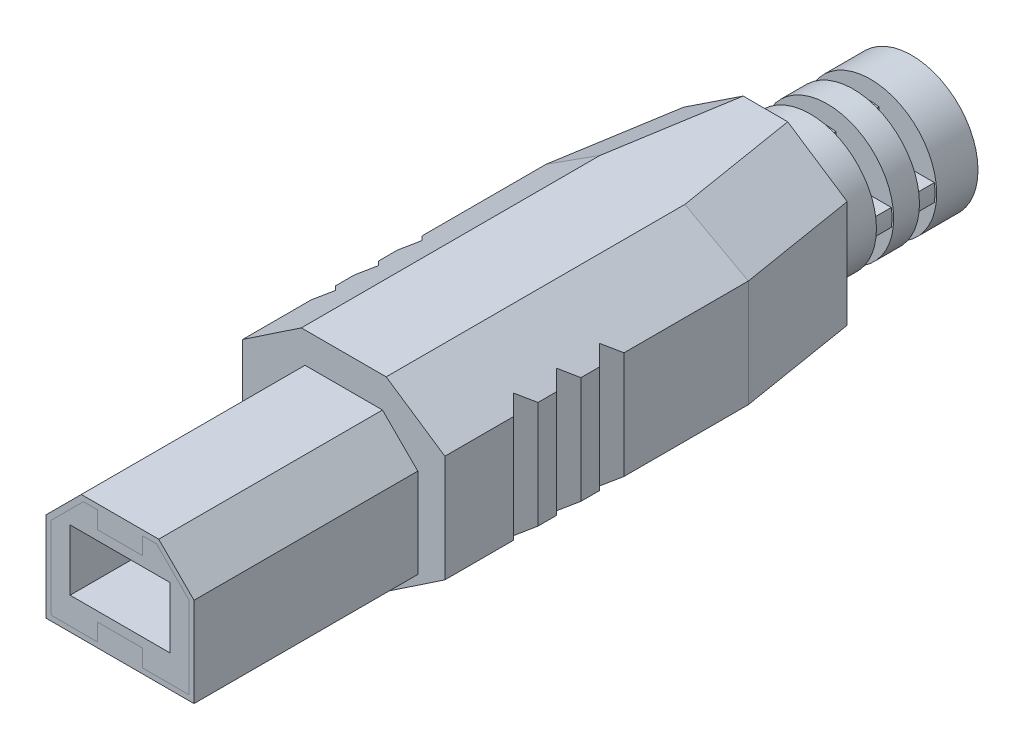
from build123d import *

# Parameters (mm, degrees)
SKETCH1_W           = 1.3
SKETCH1_H           = 0.555
BOSS_EXTRUDE1_DEPTH = 13
SKETCH3_W           = 2.9
SKETCH3_H           = 1.77
BOSS_EXTRUDE2_DEPTH = 24.5
CUT_EXTRUDE1_DEPTH  = 40.015589833
CHAMFER1_SIZE       = 3.41
CHAMFER1_SIZE_2     = 2.287970931
SKETCH7_W           = 3.85
SKETCH7_H           = 2.6
SKETCH7_H_2         = 1.5
SKETCH7_H_3         = 2.4
BOSS_EXTRUDE3_DEPTH = 6.25


with BuildPart() as part:
    # Sketch1 → Boss-Extrude1 (new body)
    with BuildSketch(Plane.XY):
        Polygon((-1.3, 0.3), (-1.3, 1.3), (-1.3, 1.855), (-2.9, 1.855), (-2.9, 5.395), (-1.3, 5.395), (-1.3, 5.95), (-1.3, 6.95), (-2.125735931, 6.95), (-4, 5.075735931), (-4, 0.3), align=None)
        with Locations((-0.65, 1.5775)):
            Rectangle(SKETCH1_W, SKETCH1_H)
        Polygon((-4.3, 0), (0, 0), (0, 1.3), (-1.3, 1.3), (-1.3, 0.3), (-4, 0.3), (-4, 5.075735931), (-2.125735931, 6.95), (-1.3, 6.95), (-1.3, 5.95), (0, 5.95), (0, 7.25), (-2.25, 7.25), (-4.3, 5.2), align=None)
        with Locations((-0.65, 5.6725)):
            Rectangle(SKETCH1_W, SKETCH1_H)
    extrude(amount=-BOSS_EXTRUDE1_DEPTH)

    # Mirror1: part across plane


with BuildPart() as part_1:
    add(part.part)
    add(part.part.mirror(Plane(origin=(0, 0, -13), x_dir=(0, 0, 1), z_dir=(-1, 0, 0))))

    # Sketch3 → Boss-Extrude2 (add)
    with BuildSketch(Plane(origin=(0, 0, -13), x_dir=(-1, 0, 0), z_dir=(0, 0, -1))):
        with Locations((1.45, 4.51)):
            Rectangle(SKETCH3_W, SKETCH3_H)
        Polygon((2.25, 7.25), (0, 7.25), (0, 5.395), (2.9, 5.395), (2.9, 3.625), (4.3, 3.625), (4.3, 5.2), align=None)
        Polygon((3.043750454, 9.025), (0, 9.025), (0, 7.25), (2.25, 7.25), (4.3, 5.2), (4.3, 3.625), (5.875, 3.625), (5.875, 7.125), (5.875, 9.025), align=None)
    extrude(amount=BOSS_EXTRUDE2_DEPTH)

    # Sketch4 → Cut-Extrude1 (cut, through all)
    with BuildSketch(Plane(origin=(0, 9.025, 0), x_dir=(1, 0, 0), z_dir=(0, 1, 0))):
        Polygon((-4.75, 37.5), (-5.875, 30.63), (-5.875, 37.5), align=None)
        Polygon((-5.875, 23.407106781), (-5.167893219, 22.7), (-5.875, 21.992893219), align=None)
        Polygon((-5.167893219, 20.2), (-5.875, 19.492893219), (-5.875, 20.907106781), align=None)
        Polygon((-5.167893219, 17.7), (-5.875, 16.992893219), (-5.875, 18.407106781), align=None)
    extrude(amount=-CUT_EXTRUDE1_DEPTH, mode=Mode.SUBTRACT)

    # Chamfer1
    # the kernel refuses this chamfer: 3.41, 2.287970931 mm, written as the material it takes off along each edge
    with BuildSketch(Plane(origin=(-5.875, 9.025, -4.189784247), x_dir=(0.9997674455612761, 0.021565129164482656, 0), z_dir=(0, 0, -1))) as chamfer1_piece_1:
        Polygon((CHAMFER1_SIZE * 0.999767445561, CHAMFER1_SIZE * 0.0215651291645), (-CHAMFER1_SIZE_2 * 0.0215651291646, CHAMFER1_SIZE_2 * 0.999767445568), (0, 0), align=None)
    extrude(amount=21.613324726, mode=Mode.SUBTRACT)
    with BuildSketch(Plane(origin=(-5.875, 9.025, -14.596891028), x_dir=(0.9997674455612761, 0.021565129164482656, 0), z_dir=(0, 0, -1))) as chamfer1_piece_2:
        Polygon((CHAMFER1_SIZE * 0.999767445561, CHAMFER1_SIZE * 0.0215651291645), (-CHAMFER1_SIZE_2 * 0.0215651291646, CHAMFER1_SIZE_2 * 0.999767445568), (0, 0), align=None)
    extrude(amount=24.843324726, mode=Mode.SUBTRACT)
    with BuildSketch(Plane(origin=(-3.326242426, 9.025, -46.194412918), x_dir=(0.986626348001283, 0.021565129164482656, 0.1615654500002101), z_dir=(-0.16160303150249725, 0, 0.9868558457085832))) as chamfer1_piece_3:
        Polygon((CHAMFER1_SIZE * 0.999767445561, -CHAMFER1_SIZE * 0.0215651291645), (-CHAMFER1_SIZE_2 * 0.0215651291646, -CHAMFER1_SIZE_2 * 0.999767445568), (0, 0), align=None)
    extrude(amount=24.581934577, mode=Mode.SUBTRACT)


with BuildPart() as body_2:
    # Split1: the piece on the far side of the plane
    add(part_1.part)
    split(bisect_by=Plane.XY.offset(-13), keep=Keep.BOTTOM)

    # Mirror9: body 2 across plane


with BuildPart() as part_2:
    add(part_1.part)

    # Split1
    split(bisect_by=Plane.XY.offset(-13), keep=Keep.TOP)


with BuildPart() as body_2_1:
    add(body_2.part)
    add(body_2.part.mirror(Plane(origin=(0, 0, -37.5), x_dir=(0, 0, 1), z_dir=(-1, 0, 0))))

    # Mirror10: body 2 across plane


with BuildPart() as body_2_2:
    add(body_2_1.part)
    add(body_2_1.part.mirror(Plane(origin=(0, 3.625, -37.5), x_dir=(0, 0, 1), z_dir=(0, 1, 0))))

    # Combine1: union part
    add(part_2.part)

    # Sketch7 → Revolve1 (revolve)
    with BuildSketch(Plane(origin=(0, 3.625, 0), x_dir=(1, 0, 0), z_dir=(0, 1, 0))):
        with Locations((1.925, 38.8)):
            Rectangle(SKETCH7_W, SKETCH7_H)
        with Locations((1.925, 41.85)):
            Rectangle(SKETCH7_W, SKETCH7_H_2)
        with Locations((1.925, 44.8)):
            Rectangle(SKETCH7_W, SKETCH7_H_3)
    revolve(axis=Axis((0, 3.625, -43.6), (0, 0, -1)))


with BuildPart() as revolve1_piece_1:
    # of the separate pieces the step leaves, piece 1, a body of its own (revolve1_pieces)
    add(body_2_2.part.solids().sort_by_distance((-5.875, 6.737029069, -13))[0])

    # Sketch5 → Boss-Extrude3 (add)
    with BuildSketch(Plane(origin=(0, 0, -37.5), x_dir=(-1, 0, 0), z_dir=(0, 0, -1))):
        with BuildLine():
            Line((-0.5, 6.329163457), (-0.5, 4.125))
            Line((-0.5, 4.125), (-3.716517187, 4.125))
            ThreePointArc((-3.716517187, 4.125), (-3.75, 3.625), (-3.716517187, 3.125))
            Line((-3.716517187, 3.125), (-0.5, 3.125))
            Line((-0.5, 3.125), (-0.5, 0.920836543))
            ThreePointArc((-0.5, 0.920836543), (0, 0.875), (0.5, 0.920836543))
            Line((0.5, 0.920836543), (0.5, 3.125))
            Line((0.5, 3.125), (3.716517187, 3.125))
            ThreePointArc((3.716517187, 3.125), (3.75, 3.625), (3.716517187, 4.125))
            Line((3.716517187, 4.125), (0.5, 4.125))
            Line((0.5, 4.125), (0.5, 6.329163457))
            ThreePointArc((0.5, 6.329163457), (0, 6.375), (-0.5, 6.329163457))
        make_face()
    extrude(amount=BOSS_EXTRUDE3_DEPTH)


with BuildPart() as revolve1_piece_2:
    # of the separate pieces the step leaves, piece 2, a body of its own (revolve1_pieces)
    add(body_2_2.part.solids().sort_by_distance((3.85, 3.625, -43.6))[0])


with BuildPart() as revolve1_piece_3:
    # of the separate pieces the step leaves, piece 3, a body of its own (revolve1_pieces)
    add(body_2_2.part.solids().sort_by_distance((3.85, 3.625, -41.1))[0])


solid = Compound([revolve1_piece_1.part, revolve1_piece_2.part, revolve1_piece_3.part])
